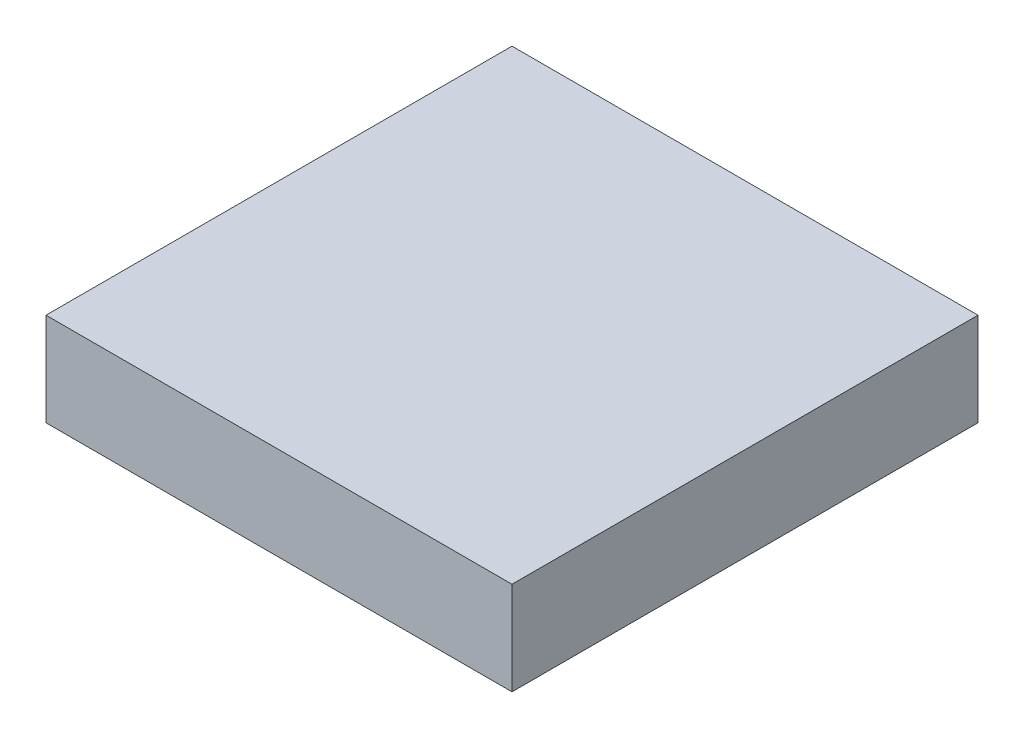
from build123d import *

# Parameters (mm, degrees)
SKETCH1_W           = 150
SKETCH1_H           = 150
BOSS_EXTRUDE1_DEPTH = 30
SHELL1_T            = -7.5


with BuildPart() as part:
    # Sketch1 → Boss-Extrude1 (new body)
    with BuildSketch(Plane(origin=(0, 0, 0), x_dir=(1, 0, 0), z_dir=(0, 1, 0))):
        Rectangle(SKETCH1_W, SKETCH1_H)
    extrude(amount=BOSS_EXTRUDE1_DEPTH)

    # Shell1
    shell1_openings = [part.faces().sort_by_distance(p)[0] for p in [
        (0, 0, 0),
    ]]
    offset(amount=SHELL1_T, openings=shell1_openings, kind=Kind.INTERSECTION)


solid = part.part
